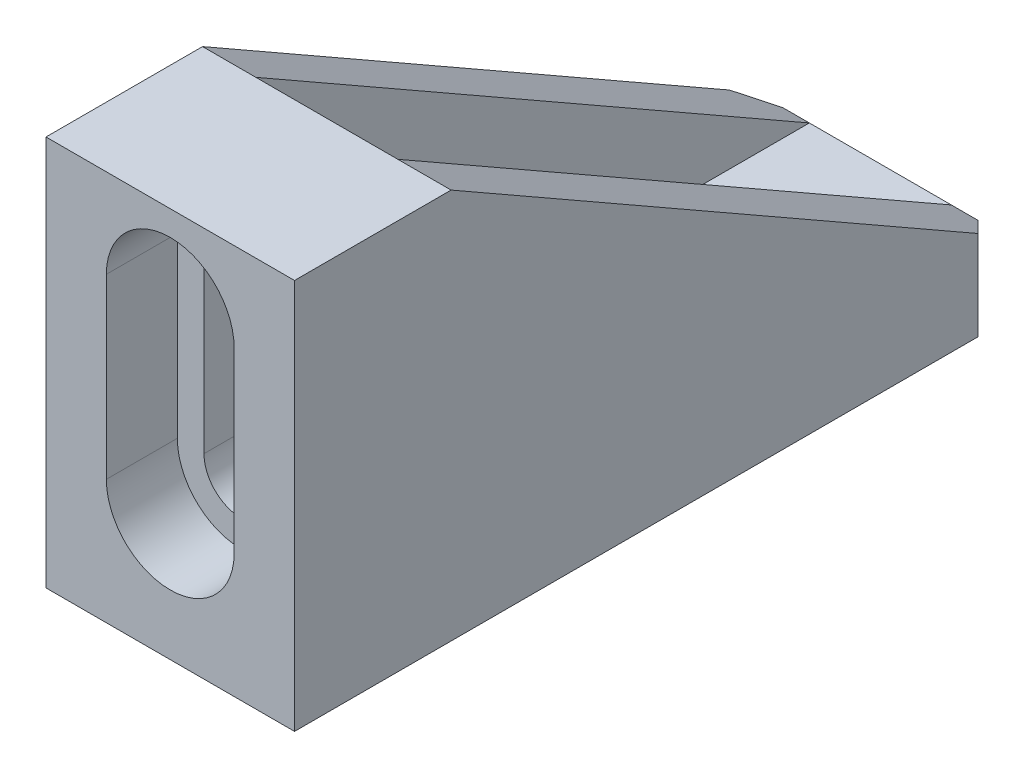
from build123d import *

# Parameters (mm, degrees)
SALIENTE_EXTRUIR1_DEPTH = 40
CORTAR_EXTRUIR1_DEPTH   = 4
CORTAR_EXTRUIR2_DEPTH   = 45.955533586
CROQUIS4_W              = 8
CROQUIS4_H              = 31.180864131
CORTAR_EXTRUIR3_DEPTH   = 17.81659
CROQUIS5_W              = 6.9
CROQUIS5_H              = 16.9
CORTAR_EXTRUIR4_DEPTH   = 1.819135869
CROQUIS6_R              = 2.5
CORTAR_EXTRUIR5_DEPTH   = 45.34445566
CHAFL_N1_SIZE           = 1.5
CHAFL_N2_SIZE           = 1.5


with BuildPart() as part:
    # Croquis1 → Saliente-Extruir1 (new body)
    with BuildSketch(Plane.XY):
        Polygon((-7, 7), (-7, 15), (7, 15), (7, 7), (7, -7), (-7, -7), align=None)
        with BuildLine():
            Line((-2.1, 0), (-2.1, 10))
            ThreePointArc((-2.1, 10), (0, 12.1), (2.1, 10))
            Line((2.1, 10), (2.1, 0))
            ThreePointArc((2.1, 0), (0, -2.1), (-2.1, 0))
        make_face(mode=Mode.SUBTRACT)
    extrude(amount=SALIENTE_EXTRUIR1_DEPTH)

    # Croquis2 → Cortar-Extruir1 (cut)
    with BuildSketch(Plane.XY.offset(40)):
        with BuildLine():
            Line((-3.6, 0), (-3.6, 10))
            ThreePointArc((-3.6, 10), (0, 13.6), (3.6, 10))
            Line((3.6, 10), (3.6, 0))
            ThreePointArc((3.6, 0), (0, -3.6), (-3.6, 0))
        make_face()
    extrude(amount=-CORTAR_EXTRUIR1_DEPTH, mode=Mode.SUBTRACT)

    # Croquis3 → Cortar-Extruir2 (cut, through all)
    with BuildSketch(Plane(origin=(7, 0, 0), x_dir=(0, 0, -1), z_dir=(1, 0, 0))):
        Polygon((0, 15), (-31.180864131, 15), (0, -2.81658631), align=None)
    extrude(amount=-CORTAR_EXTRUIR2_DEPTH, mode=Mode.SUBTRACT)

    # Croquis4 → Cortar-Extruir3 (cut)
    with BuildSketch(Plane(origin=(0, 15, 0), x_dir=(1, 0, 0), z_dir=(0, 1, 0))):
        with Locations((0, -15.590432066)):
            Rectangle(CROQUIS4_W, CROQUIS4_H)
    extrude(amount=-CORTAR_EXTRUIR3_DEPTH, mode=Mode.SUBTRACT)

    # Croquis5 → Cortar-Extruir4 (cut)
    with BuildSketch(Plane(origin=(0, 0, 31.180864131), x_dir=(-1, 0, 0), z_dir=(0, 0, -1))):
        with Locations((0, 5)):
            Rectangle(CROQUIS5_W, CROQUIS5_H)
    extrude(amount=-CORTAR_EXTRUIR4_DEPTH, mode=Mode.SUBTRACT)

    # Croquis6 → Cortar-Extruir5 (cut, through all)
    with BuildSketch(Plane(origin=(0, -2.81658631, 0), x_dir=(1, 0, 0), z_dir=(0, 1, 0))):
        with Locations(Location((0, -9.180864131, 0), (0, 0, 270))):
            Circle(CROQUIS6_R)
        with Locations(Location((0, -25.180864131, 0), (0, 0, 270))):
            Circle(CROQUIS6_R)
    extrude(amount=-CORTAR_EXTRUIR5_DEPTH, mode=Mode.SUBTRACT)

    # Chaflán1
    chafl_n1_edges = [part.edges().sort_by_distance(p)[0] for p in [
        (0, -2.81659, 6.680864131),
        (0, -2.81659, 22.680864131),
    ]]
    chamfer(chafl_n1_edges, length=CHAFL_N1_SIZE - 0.0001)  # a hair under: the kernel refuses the full size

    # Chaflán2
    chafl_n2_edges = [part.edges().sort_by_distance(p)[0] for p in [
        (-7, -4.908293155, 0),
        (7, -4.908293155, 0),
    ]]
    chamfer(chafl_n2_edges, length=CHAFL_N2_SIZE)


solid = part.part
